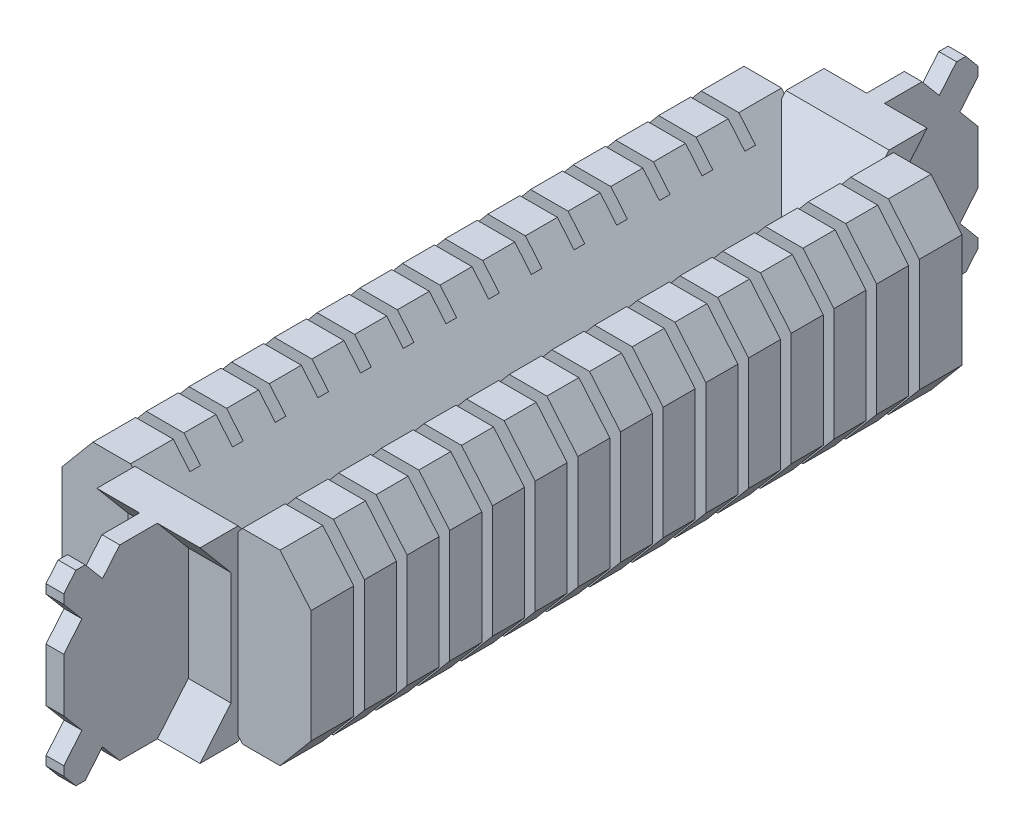
from build123d import *

# Parameters (mm, degrees)
AUFSATZ_LINEAR_AUSTRAGEN2_DEPTH      = 1.8
SCHNITT_LINEAR_AUSTRAGEN1_DEPTH      = 0.5
SCHNITT_LINEAR_AUSTRAGEN2_DEPTH      = 26.347386453
AUFSATZ_LINEAR_AUSTRAGEN3_DEPTH      = 1.2
SCHNITT_LINEAR_AUSTRAGEN3_DEPTH      = 26.734995629
LINEARES_MUSTER1_COUNT               = 15
LINEARES_MUSTER1_PITCH               = 4.8
LINEARES_MUSTER1_COPY_1_DEPTH        = 0.5
LINEARES_MUSTER1_COPY_2_DEPTH        = 0.5
LINEARES_MUSTER1_COPY_3_DEPTH        = 0.5
LINEARES_MUSTER1_COPY_4_DEPTH        = 0.5
LINEARES_MUSTER1_COPY_5_DEPTH        = 0.5
LINEARES_MUSTER1_COPY_6_DEPTH        = 0.5
LINEARES_MUSTER1_COPY_7_DEPTH        = 0.5
LINEARES_MUSTER1_COPY_8_DEPTH        = 0.5
LINEARES_MUSTER1_COPY_9_DEPTH        = 0.5
LINEARES_MUSTER1_COPY_10_DEPTH       = 0.5
LINEARES_MUSTER1_COPY_11_DEPTH       = 0.5
LINEARES_MUSTER1_COPY_12_DEPTH       = 0.5
LINEARES_MUSTER1_COPY_13_DEPTH       = 0.5
LINEARES_MUSTER1_COPY_14_DEPTH       = 0.5
LINEARES_MUSTER1_COPY_15_DEPTH       = 26.347386453
LINEARES_MUSTER1_COPY_16_DEPTH       = 26.347386453
LINEARES_MUSTER1_COPY_17_DEPTH       = 26.347386453
LINEARES_MUSTER1_COPY_18_DEPTH       = 26.347386453
LINEARES_MUSTER1_COPY_19_DEPTH       = 26.347386453
LINEARES_MUSTER1_COPY_20_DEPTH       = 26.347386453
LINEARES_MUSTER1_COPY_21_DEPTH       = 26.347386453
LINEARES_MUSTER1_COPY_22_DEPTH       = 26.347386453
LINEARES_MUSTER1_COPY_23_DEPTH       = 26.347386453
LINEARES_MUSTER1_COPY_24_DEPTH       = 26.347386453
LINEARES_MUSTER1_COPY_25_DEPTH       = 26.347386453
LINEARES_MUSTER1_COPY_26_DEPTH       = 26.347386453
LINEARES_MUSTER1_COPY_27_DEPTH       = 26.347386453
LINEARES_MUSTER1_COPY_28_DEPTH       = 26.347386453
LINEARES_MUSTER1_COPY_29_DEPTH       = 26.734995629
LINEARES_MUSTER1_COPY_30_DEPTH       = 26.734995629
LINEARES_MUSTER1_COPY_31_DEPTH       = 26.734995629
LINEARES_MUSTER1_COPY_32_DEPTH       = 26.734995629
LINEARES_MUSTER1_COPY_33_DEPTH       = 26.734995629
LINEARES_MUSTER1_COPY_34_DEPTH       = 26.734995629
LINEARES_MUSTER1_COPY_35_DEPTH       = 26.734995629
LINEARES_MUSTER1_COPY_36_DEPTH       = 26.734995629
LINEARES_MUSTER1_COPY_37_DEPTH       = 26.734995629
LINEARES_MUSTER1_COPY_38_DEPTH       = 26.734995629
LINEARES_MUSTER1_COPY_39_DEPTH       = 26.734995629
LINEARES_MUSTER1_COPY_40_DEPTH       = 26.734995629
LINEARES_MUSTER1_COPY_41_DEPTH       = 26.734995629
LINEARES_MUSTER1_COPY_42_DEPTH       = 26.734995629
AUFSATZ_LINEAR_AUSTRAGEN4_DEPTH      = 1.2
AUFSATZ_LINEAR_AUSTRAGEN4_DEPTH_BACK = 0.8
AUFSATZ_LINEAR_AUSTRAGEN5_DEPTH      = 1.2
AUFSATZ_LINEAR_AUSTRAGEN5_DEPTH_BACK = 0.8
AUFSATZ_LINEAR_AUSTRAGEN6_DEPTH      = 1
AUFSATZ_LINEAR_AUSTRAGEN7_DEPTH      = 4.8
SPIEGELN11_COPY_1_DEPTH              = 4.8
SPIEGELN11_COPY_2_DEPTH              = 4.8
SCHNITT_LINEAR_AUSTRAGEN6_DEPTH      = 87.949698102


with BuildPart() as part:
    # Skizze3 → Aufsatz-Linear austragen2 (new, symmetric)
    with BuildSketch(Plane.XY):
        Polygon((-9, 3), (-2.706752766, 10.5), (1.519985058, 10.5), (5, 6.352679691), (5, -6.352679691), (1.519985058, -10.5), (-2.706752766, -10.5), (-9, -3), (-15.293247234, -10.5), (-19.519985058, -10.5), (-23, -6.352679691), (-23, 6.352679691), (-19.519985058, 10.5), (-15.293247234, 10.5), align=None)
    aufsatz_linear_austragen2 = extrude(amount=AUFSATZ_LINEAR_AUSTRAGEN2_DEPTH, both=True)

    # Skizze2 → Schnitt-Linear austragen1 (cut, symmetric)
    with BuildSketch(Plane.XY):
        Polygon((-7.551896681, 0), (0, 9), (3, 5.424739222), (3, -5.424739222), (0, -9), align=None)
    schnitt_linear_austragen1 = extrude(amount=SCHNITT_LINEAR_AUSTRAGEN1_DEPTH, both=True, mode=Mode.SUBTRACT)

    # Spiegeln2: Schnitt-Linear austragen1 across plane
    add(schnitt_linear_austragen1.mirror(Plane(origin=(-9, 0, 0), x_dir=(0, 0, 1), z_dir=(1, 0, 0))), mode=Mode.SUBTRACT)

    # Skizze5 → Schnitt-Linear austragen2 (cut, symmetric)
    with BuildSketch(Plane.XY):
        Polygon((-7.551896681, 0), (-6.716272788, 0.995857776), (-5.880648895, 0), (-6.716272788, -0.995857776), align=None)
    schnitt_linear_austragen2 = extrude(amount=SCHNITT_LINEAR_AUSTRAGEN2_DEPTH, both=True, mode=Mode.SUBTRACT)

    # Spiegeln3: Schnitt-Linear austragen2 across plane
    add(schnitt_linear_austragen2.mirror(Plane(origin=(-9, 0, 0), x_dir=(0, 0, 1), z_dir=(1, 0, 0))), mode=Mode.SUBTRACT)

    # Skizze6 → Aufsatz-Linear austragen3 (add)
    with BuildSketch(Plane.XY.offset(1.8)):
        Polygon((-4.580648895, 8.266777556), (-9, 3), (-13.419351105, 8.266777556), (-13.419351105, -8.266777556), (-9, -3), (-4.580648895, -8.266777556), align=None)
    aufsatz_linear_austragen3 = extrude(amount=AUFSATZ_LINEAR_AUSTRAGEN3_DEPTH)

    # Skizze7 → Schnitt-Linear austragen3 (cut, through all)
    with BuildSketch(Plane(origin=(0, 0, -1.8), x_dir=(-1, 0, 0), z_dir=(0, 0, -1))):
        Polygon((6.716272788, -0.995857776), (7.551896681, 0), (6.716272788, 0.995857776), (5.880648895, 0), align=None)
    schnitt_linear_austragen3 = extrude(amount=-SCHNITT_LINEAR_AUSTRAGEN3_DEPTH, mode=Mode.SUBTRACT)

    # Spiegeln4: Schnitt-Linear austragen3 across plane
    add(schnitt_linear_austragen3.mirror(Plane(origin=(-9, 0, 0), x_dir=(0, 0, 1), z_dir=(1, 0, 0))), mode=Mode.SUBTRACT)

    # Lineares Muster1: Aufsatz-Linear austragen2, Schnitt-Linear austragen1, Schnitt-Linear austragen2, Aufsatz-Linear austragen3, Schnitt-Linear austragen3 ×15
    with Locations(*[(0, 0, i * LINEARES_MUSTER1_PITCH) for i in range(1, LINEARES_MUSTER1_COUNT)]):
        add(aufsatz_linear_austragen2)
        add(schnitt_linear_austragen1, mode=Mode.SUBTRACT)
        add(schnitt_linear_austragen2, mode=Mode.SUBTRACT)
        add(aufsatz_linear_austragen3)
        add(schnitt_linear_austragen3, mode=Mode.SUBTRACT)

    # Lineares Muster1 copy 1 sketch → Lineares Muster1 copy 1 (cut, symmetric)
    with BuildSketch(Plane(origin=(-18, 0, 4.8), x_dir=(-1, 0, 0), z_dir=(0, 0, 1))):
        Polygon((-7.551896681, 0), (0, -9), (3, -5.424739222), (3, 5.424739222), (0, 9), align=None)
    extrude(amount=LINEARES_MUSTER1_COPY_1_DEPTH, both=True, mode=Mode.SUBTRACT)

    # Lineares Muster1 copy 2 sketch → Lineares Muster1 copy 2 (cut, symmetric)
    with BuildSketch(Plane(origin=(-18, 0, 9.6), x_dir=(-1, 0, 0), z_dir=(0, 0, 1))):
        Polygon((-7.551896681, 0), (0, -9), (3, -5.424739222), (3, 5.424739222), (0, 9), align=None)
    extrude(amount=LINEARES_MUSTER1_COPY_2_DEPTH, both=True, mode=Mode.SUBTRACT)

    # Lineares Muster1 copy 3 sketch → Lineares Muster1 copy 3 (cut, symmetric)
    with BuildSketch(Plane(origin=(-18, 0, 14.4), x_dir=(-1, 0, 0), z_dir=(0, 0, 1))):
        Polygon((-7.551896681, 0), (0, -9), (3, -5.424739222), (3, 5.424739222), (0, 9), align=None)
    extrude(amount=LINEARES_MUSTER1_COPY_3_DEPTH, both=True, mode=Mode.SUBTRACT)

    # Lineares Muster1 copy 4 sketch → Lineares Muster1 copy 4 (cut, symmetric)
    with BuildSketch(Plane(origin=(-18, 0, 19.2), x_dir=(-1, 0, 0), z_dir=(0, 0, 1))):
        Polygon((-7.551896681, 0), (0, -9), (3, -5.424739222), (3, 5.424739222), (0, 9), align=None)
    extrude(amount=LINEARES_MUSTER1_COPY_4_DEPTH, both=True, mode=Mode.SUBTRACT)

    # Lineares Muster1 copy 5 sketch → Lineares Muster1 copy 5 (cut, symmetric)
    with BuildSketch(Plane(origin=(-18, 0, 24), x_dir=(-1, 0, 0), z_dir=(0, 0, 1))):
        Polygon((-7.551896681, 0), (0, -9), (3, -5.424739222), (3, 5.424739222), (0, 9), align=None)
    extrude(amount=LINEARES_MUSTER1_COPY_5_DEPTH, both=True, mode=Mode.SUBTRACT)

    # Lineares Muster1 copy 6 sketch → Lineares Muster1 copy 6 (cut, symmetric)
    with BuildSketch(Plane(origin=(-18, 0, 28.8), x_dir=(-1, 0, 0), z_dir=(0, 0, 1))):
        Polygon((-7.551896681, 0), (0, -9), (3, -5.424739222), (3, 5.424739222), (0, 9), align=None)
    extrude(amount=LINEARES_MUSTER1_COPY_6_DEPTH, both=True, mode=Mode.SUBTRACT)

    # Lineares Muster1 copy 7 sketch → Lineares Muster1 copy 7 (cut, symmetric)
    with BuildSketch(Plane(origin=(-18, 0, 33.6), x_dir=(-1, 0, 0), z_dir=(0, 0, 1))):
        Polygon((-7.551896681, 0), (0, -9), (3, -5.424739222), (3, 5.424739222), (0, 9), align=None)
    extrude(amount=LINEARES_MUSTER1_COPY_7_DEPTH, both=True, mode=Mode.SUBTRACT)

    # Lineares Muster1 copy 8 sketch → Lineares Muster1 copy 8 (cut, symmetric)
    with BuildSketch(Plane(origin=(-18, 0, 38.4), x_dir=(-1, 0, 0), z_dir=(0, 0, 1))):
        Polygon((-7.551896681, 0), (0, -9), (3, -5.424739222), (3, 5.424739222), (0, 9), align=None)
    extrude(amount=LINEARES_MUSTER1_COPY_8_DEPTH, both=True, mode=Mode.SUBTRACT)

    # Lineares Muster1 copy 9 sketch → Lineares Muster1 copy 9 (cut, symmetric)
    with BuildSketch(Plane(origin=(-18, 0, 43.2), x_dir=(-1, 0, 0), z_dir=(0, 0, 1))):
        Polygon((-7.551896681, 0), (0, -9), (3, -5.424739222), (3, 5.424739222), (0, 9), align=None)
    extrude(amount=LINEARES_MUSTER1_COPY_9_DEPTH, both=True, mode=Mode.SUBTRACT)

    # Lineares Muster1 copy 10 sketch → Lineares Muster1 copy 10 (cut, symmetric)
    with BuildSketch(Plane(origin=(-18, 0, 48), x_dir=(-1, 0, 0), z_dir=(0, 0, 1))):
        Polygon((-7.551896681, 0), (0, -9), (3, -5.424739222), (3, 5.424739222), (0, 9), align=None)
    extrude(amount=LINEARES_MUSTER1_COPY_10_DEPTH, both=True, mode=Mode.SUBTRACT)

    # Lineares Muster1 copy 11 sketch → Lineares Muster1 copy 11 (cut, symmetric)
    with BuildSketch(Plane(origin=(-18, 0, 52.8), x_dir=(-1, 0, 0), z_dir=(0, 0, 1))):
        Polygon((-7.551896681, 0), (0, -9), (3, -5.424739222), (3, 5.424739222), (0, 9), align=None)
    extrude(amount=LINEARES_MUSTER1_COPY_11_DEPTH, both=True, mode=Mode.SUBTRACT)

    # Lineares Muster1 copy 12 sketch → Lineares Muster1 copy 12 (cut, symmetric)
    with BuildSketch(Plane(origin=(-18, 0, 57.6), x_dir=(-1, 0, 0), z_dir=(0, 0, 1))):
        Polygon((-7.551896681, 0), (0, -9), (3, -5.424739222), (3, 5.424739222), (0, 9), align=None)
    extrude(amount=LINEARES_MUSTER1_COPY_12_DEPTH, both=True, mode=Mode.SUBTRACT)

    # Lineares Muster1 copy 13 sketch → Lineares Muster1 copy 13 (cut, symmetric)
    with BuildSketch(Plane(origin=(-18, 0, 62.4), x_dir=(-1, 0, 0), z_dir=(0, 0, 1))):
        Polygon((-7.551896681, 0), (0, -9), (3, -5.424739222), (3, 5.424739222), (0, 9), align=None)
    extrude(amount=LINEARES_MUSTER1_COPY_13_DEPTH, both=True, mode=Mode.SUBTRACT)

    # Lineares Muster1 copy 14 sketch → Lineares Muster1 copy 14 (cut, symmetric)
    with BuildSketch(Plane(origin=(-18, 0, 67.2), x_dir=(-1, 0, 0), z_dir=(0, 0, 1))):
        Polygon((-7.551896681, 0), (0, -9), (3, -5.424739222), (3, 5.424739222), (0, 9), align=None)
    extrude(amount=LINEARES_MUSTER1_COPY_14_DEPTH, both=True, mode=Mode.SUBTRACT)

    # Lineares Muster1 copy 15 sketch → Lineares Muster1 copy 15 (cut, symmetric)
    with BuildSketch(Plane(origin=(-18, 0, 4.8), x_dir=(-1, 0, 0), z_dir=(0, 0, 1))):
        Polygon((-7.551896681, 0), (-6.716272788, -0.995857776), (-5.880648895, 0), (-6.716272788, 0.995857776), align=None)
    extrude(amount=LINEARES_MUSTER1_COPY_15_DEPTH, both=True, mode=Mode.SUBTRACT)

    # Lineares Muster1 copy 16 sketch → Lineares Muster1 copy 16 (cut, symmetric)
    with BuildSketch(Plane(origin=(-18, 0, 9.6), x_dir=(-1, 0, 0), z_dir=(0, 0, 1))):
        Polygon((-7.551896681, 0), (-6.716272788, -0.995857776), (-5.880648895, 0), (-6.716272788, 0.995857776), align=None)
    extrude(amount=LINEARES_MUSTER1_COPY_16_DEPTH, both=True, mode=Mode.SUBTRACT)

    # Lineares Muster1 copy 17 sketch → Lineares Muster1 copy 17 (cut, symmetric)
    with BuildSketch(Plane(origin=(-18, 0, 14.4), x_dir=(-1, 0, 0), z_dir=(0, 0, 1))):
        Polygon((-7.551896681, 0), (-6.716272788, -0.995857776), (-5.880648895, 0), (-6.716272788, 0.995857776), align=None)
    extrude(amount=LINEARES_MUSTER1_COPY_17_DEPTH, both=True, mode=Mode.SUBTRACT)

    # Lineares Muster1 copy 18 sketch → Lineares Muster1 copy 18 (cut, symmetric)
    with BuildSketch(Plane(origin=(-18, 0, 19.2), x_dir=(-1, 0, 0), z_dir=(0, 0, 1))):
        Polygon((-7.551896681, 0), (-6.716272788, -0.995857776), (-5.880648895, 0), (-6.716272788, 0.995857776), align=None)
    extrude(amount=LINEARES_MUSTER1_COPY_18_DEPTH, both=True, mode=Mode.SUBTRACT)

    # Lineares Muster1 copy 19 sketch → Lineares Muster1 copy 19 (cut, symmetric)
    with BuildSketch(Plane(origin=(-18, 0, 24), x_dir=(-1, 0, 0), z_dir=(0, 0, 1))):
        Polygon((-7.551896681, 0), (-6.716272788, -0.995857776), (-5.880648895, 0), (-6.716272788, 0.995857776), align=None)
    extrude(amount=LINEARES_MUSTER1_COPY_19_DEPTH, both=True, mode=Mode.SUBTRACT)

    # Lineares Muster1 copy 20 sketch → Lineares Muster1 copy 20 (cut, symmetric)
    with BuildSketch(Plane(origin=(-18, 0, 28.8), x_dir=(-1, 0, 0), z_dir=(0, 0, 1))):
        Polygon((-7.551896681, 0), (-6.716272788, -0.995857776), (-5.880648895, 0), (-6.716272788, 0.995857776), align=None)
    extrude(amount=LINEARES_MUSTER1_COPY_20_DEPTH, both=True, mode=Mode.SUBTRACT)

    # Lineares Muster1 copy 21 sketch → Lineares Muster1 copy 21 (cut, symmetric)
    with BuildSketch(Plane(origin=(-18, 0, 33.6), x_dir=(-1, 0, 0), z_dir=(0, 0, 1))):
        Polygon((-7.551896681, 0), (-6.716272788, -0.995857776), (-5.880648895, 0), (-6.716272788, 0.995857776), align=None)
    extrude(amount=LINEARES_MUSTER1_COPY_21_DEPTH, both=True, mode=Mode.SUBTRACT)

    # Lineares Muster1 copy 22 sketch → Lineares Muster1 copy 22 (cut, symmetric)
    with BuildSketch(Plane(origin=(-18, 0, 38.4), x_dir=(-1, 0, 0), z_dir=(0, 0, 1))):
        Polygon((-7.551896681, 0), (-6.716272788, -0.995857776), (-5.880648895, 0), (-6.716272788, 0.995857776), align=None)
    extrude(amount=LINEARES_MUSTER1_COPY_22_DEPTH, both=True, mode=Mode.SUBTRACT)

    # Lineares Muster1 copy 23 sketch → Lineares Muster1 copy 23 (cut, symmetric)
    with BuildSketch(Plane(origin=(-18, 0, 43.2), x_dir=(-1, 0, 0), z_dir=(0, 0, 1))):
        Polygon((-7.551896681, 0), (-6.716272788, -0.995857776), (-5.880648895, 0), (-6.716272788, 0.995857776), align=None)
    extrude(amount=LINEARES_MUSTER1_COPY_23_DEPTH, both=True, mode=Mode.SUBTRACT)

    # Lineares Muster1 copy 24 sketch → Lineares Muster1 copy 24 (cut, symmetric)
    with BuildSketch(Plane(origin=(-18, 0, 48), x_dir=(-1, 0, 0), z_dir=(0, 0, 1))):
        Polygon((-7.551896681, 0), (-6.716272788, -0.995857776), (-5.880648895, 0), (-6.716272788, 0.995857776), align=None)
    extrude(amount=LINEARES_MUSTER1_COPY_24_DEPTH, both=True, mode=Mode.SUBTRACT)

    # Lineares Muster1 copy 25 sketch → Lineares Muster1 copy 25 (cut, symmetric)
    with BuildSketch(Plane(origin=(-18, 0, 52.8), x_dir=(-1, 0, 0), z_dir=(0, 0, 1))):
        Polygon((-7.551896681, 0), (-6.716272788, -0.995857776), (-5.880648895, 0), (-6.716272788, 0.995857776), align=None)
    extrude(amount=LINEARES_MUSTER1_COPY_25_DEPTH, both=True, mode=Mode.SUBTRACT)

    # Lineares Muster1 copy 26 sketch → Lineares Muster1 copy 26 (cut, symmetric)
    with BuildSketch(Plane(origin=(-18, 0, 57.6), x_dir=(-1, 0, 0), z_dir=(0, 0, 1))):
        Polygon((-7.551896681, 0), (-6.716272788, -0.995857776), (-5.880648895, 0), (-6.716272788, 0.995857776), align=None)
    extrude(amount=LINEARES_MUSTER1_COPY_26_DEPTH, both=True, mode=Mode.SUBTRACT)

    # Lineares Muster1 copy 27 sketch → Lineares Muster1 copy 27 (cut, symmetric)
    with BuildSketch(Plane(origin=(-18, 0, 62.4), x_dir=(-1, 0, 0), z_dir=(0, 0, 1))):
        Polygon((-7.551896681, 0), (-6.716272788, -0.995857776), (-5.880648895, 0), (-6.716272788, 0.995857776), align=None)
    extrude(amount=LINEARES_MUSTER1_COPY_27_DEPTH, both=True, mode=Mode.SUBTRACT)

    # Lineares Muster1 copy 28 sketch → Lineares Muster1 copy 28 (cut, symmetric)
    with BuildSketch(Plane(origin=(-18, 0, 67.2), x_dir=(-1, 0, 0), z_dir=(0, 0, 1))):
        Polygon((-7.551896681, 0), (-6.716272788, -0.995857776), (-5.880648895, 0), (-6.716272788, 0.995857776), align=None)
    extrude(amount=LINEARES_MUSTER1_COPY_28_DEPTH, both=True, mode=Mode.SUBTRACT)

    # Lineares Muster1 copy 29 sketch → Lineares Muster1 copy 29 (cut, through all)
    with BuildSketch(Plane(origin=(-18, 0, 3), x_dir=(1, 0, 0), z_dir=(0, 0, -1))):
        Polygon((6.716272788, 0.995857776), (7.551896681, 0), (6.716272788, -0.995857776), (5.880648895, 0), align=None)
    extrude(amount=-LINEARES_MUSTER1_COPY_29_DEPTH, mode=Mode.SUBTRACT)

    # Lineares Muster1 copy 30 sketch → Lineares Muster1 copy 30 (cut, through all)
    with BuildSketch(Plane(origin=(-18, 0, 7.8), x_dir=(1, 0, 0), z_dir=(0, 0, -1))):
        Polygon((6.716272788, 0.995857776), (7.551896681, 0), (6.716272788, -0.995857776), (5.880648895, 0), align=None)
    extrude(amount=-LINEARES_MUSTER1_COPY_30_DEPTH, mode=Mode.SUBTRACT)

    # Lineares Muster1 copy 31 sketch → Lineares Muster1 copy 31 (cut, through all)
    with BuildSketch(Plane(origin=(-18, 0, 12.6), x_dir=(1, 0, 0), z_dir=(0, 0, -1))):
        Polygon((6.716272788, 0.995857776), (7.551896681, 0), (6.716272788, -0.995857776), (5.880648895, 0), align=None)
    extrude(amount=-LINEARES_MUSTER1_COPY_31_DEPTH, mode=Mode.SUBTRACT)

    # Lineares Muster1 copy 32 sketch → Lineares Muster1 copy 32 (cut, through all)
    with BuildSketch(Plane(origin=(-18, 0, 17.4), x_dir=(1, 0, 0), z_dir=(0, 0, -1))):
        Polygon((6.716272788, 0.995857776), (7.551896681, 0), (6.716272788, -0.995857776), (5.880648895, 0), align=None)
    extrude(amount=-LINEARES_MUSTER1_COPY_32_DEPTH, mode=Mode.SUBTRACT)

    # Lineares Muster1 copy 33 sketch → Lineares Muster1 copy 33 (cut, through all)
    with BuildSketch(Plane(origin=(-18, 0, 22.2), x_dir=(1, 0, 0), z_dir=(0, 0, -1))):
        Polygon((6.716272788, 0.995857776), (7.551896681, 0), (6.716272788, -0.995857776), (5.880648895, 0), align=None)
    extrude(amount=-LINEARES_MUSTER1_COPY_33_DEPTH, mode=Mode.SUBTRACT)

    # Lineares Muster1 copy 34 sketch → Lineares Muster1 copy 34 (cut, through all)
    with BuildSketch(Plane(origin=(-18, 0, 27), x_dir=(1, 0, 0), z_dir=(0, 0, -1))):
        Polygon((6.716272788, 0.995857776), (7.551896681, 0), (6.716272788, -0.995857776), (5.880648895, 0), align=None)
    extrude(amount=-LINEARES_MUSTER1_COPY_34_DEPTH, mode=Mode.SUBTRACT)

    # Lineares Muster1 copy 35 sketch → Lineares Muster1 copy 35 (cut, through all)
    with BuildSketch(Plane(origin=(-18, 0, 31.8), x_dir=(1, 0, 0), z_dir=(0, 0, -1))):
        Polygon((6.716272788, 0.995857776), (7.551896681, 0), (6.716272788, -0.995857776), (5.880648895, 0), align=None)
    extrude(amount=-LINEARES_MUSTER1_COPY_35_DEPTH, mode=Mode.SUBTRACT)

    # Lineares Muster1 copy 36 sketch → Lineares Muster1 copy 36 (cut, through all)
    with BuildSketch(Plane(origin=(-18, 0, 36.6), x_dir=(1, 0, 0), z_dir=(0, 0, -1))):
        Polygon((6.716272788, 0.995857776), (7.551896681, 0), (6.716272788, -0.995857776), (5.880648895, 0), align=None)
    extrude(amount=-LINEARES_MUSTER1_COPY_36_DEPTH, mode=Mode.SUBTRACT)

    # Lineares Muster1 copy 37 sketch → Lineares Muster1 copy 37 (cut, through all)
    with BuildSketch(Plane(origin=(-18, 0, 41.4), x_dir=(1, 0, 0), z_dir=(0, 0, -1))):
        Polygon((6.716272788, 0.995857776), (7.551896681, 0), (6.716272788, -0.995857776), (5.880648895, 0), align=None)
    extrude(amount=-LINEARES_MUSTER1_COPY_37_DEPTH, mode=Mode.SUBTRACT)

    # Lineares Muster1 copy 38 sketch → Lineares Muster1 copy 38 (cut, through all)
    with BuildSketch(Plane(origin=(-18, 0, 46.2), x_dir=(1, 0, 0), z_dir=(0, 0, -1))):
        Polygon((6.716272788, 0.995857776), (7.551896681, 0), (6.716272788, -0.995857776), (5.880648895, 0), align=None)
    extrude(amount=-LINEARES_MUSTER1_COPY_38_DEPTH, mode=Mode.SUBTRACT)

    # Lineares Muster1 copy 39 sketch → Lineares Muster1 copy 39 (cut, through all)
    with BuildSketch(Plane(origin=(-18, 0, 51), x_dir=(1, 0, 0), z_dir=(0, 0, -1))):
        Polygon((6.716272788, 0.995857776), (7.551896681, 0), (6.716272788, -0.995857776), (5.880648895, 0), align=None)
    extrude(amount=-LINEARES_MUSTER1_COPY_39_DEPTH, mode=Mode.SUBTRACT)

    # Lineares Muster1 copy 40 sketch → Lineares Muster1 copy 40 (cut, through all)
    with BuildSketch(Plane(origin=(-18, 0, 55.8), x_dir=(1, 0, 0), z_dir=(0, 0, -1))):
        Polygon((6.716272788, 0.995857776), (7.551896681, 0), (6.716272788, -0.995857776), (5.880648895, 0), align=None)
    extrude(amount=-LINEARES_MUSTER1_COPY_40_DEPTH, mode=Mode.SUBTRACT)

    # Lineares Muster1 copy 41 sketch → Lineares Muster1 copy 41 (cut, through all)
    with BuildSketch(Plane(origin=(-18, 0, 60.6), x_dir=(1, 0, 0), z_dir=(0, 0, -1))):
        Polygon((6.716272788, 0.995857776), (7.551896681, 0), (6.716272788, -0.995857776), (5.880648895, 0), align=None)
    extrude(amount=-LINEARES_MUSTER1_COPY_41_DEPTH, mode=Mode.SUBTRACT)

    # Lineares Muster1 copy 42 sketch → Lineares Muster1 copy 42 (cut, through all)
    with BuildSketch(Plane(origin=(-18, 0, 65.4), x_dir=(1, 0, 0), z_dir=(0, 0, -1))):
        Polygon((6.716272788, 0.995857776), (7.551896681, 0), (6.716272788, -0.995857776), (5.880648895, 0), align=None)
    extrude(amount=-LINEARES_MUSTER1_COPY_42_DEPTH, mode=Mode.SUBTRACT)

    # Skizze8 → Aufsatz-Linear austragen4 (add, two sides: drawn at the far end of the back side and taken through both)
    with BuildSketch(Plane(origin=(0, 0, -1.8), x_dir=(-1, 0, 0), z_dir=(0, 0, -1)).offset(-AUFSATZ_LINEAR_AUSTRAGEN4_DEPTH_BACK)):
        Polygon((2.706752766, -10.5), (9, -3), (15.293247234, -10.5), (19.519985058, -10.5), (23, -6.352679691), (23, 6.352679691), (19.519985058, 10.5), (15.293247234, 10.5), (9, 3), (2.706752766, 10.5), (-1.519985058, 10.5), (-5, 6.352679691), (-5, -6.352679691), (-1.519985058, -10.5), align=None)
    extrude(amount=AUFSATZ_LINEAR_AUSTRAGEN4_DEPTH + AUFSATZ_LINEAR_AUSTRAGEN4_DEPTH_BACK)

    # Skizze9 → Aufsatz-Linear austragen5 (add, two sides: drawn at the far end of the back side and taken through both)
    with BuildSketch(Plane.XY.offset(69).offset(-AUFSATZ_LINEAR_AUSTRAGEN5_DEPTH_BACK)):
        Polygon((-2.706752766, -10.5), (1.519985058, -10.5), (5, -6.352679691), (5, 6.352679691), (1.519985058, 10.5), (-2.706752766, 10.5), (-9, 3), (-15.293247234, 10.5), (-19.519985058, 10.5), (-23, 6.352679691), (-23, -6.352679691), (-19.519985058, -10.5), (-15.293247234, -10.5), (-9, -3), align=None)
    extrude(amount=AUFSATZ_LINEAR_AUSTRAGEN5_DEPTH + AUFSATZ_LINEAR_AUSTRAGEN5_DEPTH_BACK)

    # Skizze10 → Aufsatz-Linear austragen6 (add, symmetric)
    with BuildSketch(Plane(origin=(-9, 0, 0), x_dir=(0, 0, -1), z_dir=(1, 0, 0))):
        Polygon((-3.293247234, 3), (3, 10.5), (17.8, 10.5), (17.8, -10.5), (3, -10.5), (-3.293247234, -3), (3, -3), (3, 3), align=None)
    aufsatz_linear_austragen6 = extrude(amount=AUFSATZ_LINEAR_AUSTRAGEN6_DEPTH, both=True)

    # Spiegeln5: Aufsatz-Linear austragen6 across plane
    add(aufsatz_linear_austragen6.mirror(Plane.XY.offset(33.6)))

    # Skizze12 → Aufsatz-Linear austragen7 (add)
    with BuildSketch(Plane(origin=(-8, 0, 0), x_dir=(0, 0, -1), z_dir=(1, 0, 0))):
        Polygon((-2.293247234, 4.191753593), (3, 10.5), (7.280014942, 10.5), (3.8, 6.352679691), (3.8, -6.352679691), (7.280014942, -10.5), (3, -10.5), (-2.293247234, -4.191753593), (3, -4.191753593), (3, 4.191753593), align=None)
    aufsatz_linear_austragen7 = extrude(amount=AUFSATZ_LINEAR_AUSTRAGEN7_DEPTH)

    # Spiegeln6: Aufsatz-Linear austragen7 across plane
    add(aufsatz_linear_austragen7.mirror(Plane.XY.offset(33.6)))

    # Spiegeln10: Aufsatz-Linear austragen7 across plane
    add(aufsatz_linear_austragen7.mirror(Plane(origin=(-9, 0, 0), x_dir=(0, 0, 1), z_dir=(1, 0, 0))))

    # Spiegeln11 copy 1 sketch → Spiegeln11 copy 1 (add)
    with BuildSketch(Plane(origin=(-10, 0, 67.2), x_dir=(0, 0, 1), z_dir=(-1, 0, 0))):
        Polygon((-2.293247234, 4.191753593), (3, 10.5), (7.280014942, 10.5), (3.8, 6.352679691), (3.8, -6.352679691), (7.280014942, -10.5), (3, -10.5), (-2.293247234, -4.191753593), (3, -4.191753593), (3, 4.191753593), align=None)
    extrude(amount=SPIEGELN11_COPY_1_DEPTH)

    # Spiegeln11 copy 2 sketch → Spiegeln11 copy 2 (add)
    with BuildSketch(Plane(origin=(-8, 0, 67.2), x_dir=(0, 0, 1), z_dir=(1, 0, 0))):
        Polygon((-2.293247234, -4.191753593), (3, -10.5), (7.280014942, -10.5), (3.8, -6.352679691), (3.8, 6.352679691), (7.280014942, 10.5), (3, 10.5), (-2.293247234, 4.191753593), (3, 4.191753593), (3, -4.191753593), align=None)
    extrude(amount=SPIEGELN11_COPY_2_DEPTH)

    # Skizze16 → Schnitt-Linear austragen6 (cut, through all)
    with BuildSketch(Plane(origin=(-8, 0, 0), x_dir=(0, 0, -1), z_dir=(1, 0, 0))):
        Polygon((17.8, 3), (15.76212397, 5.42864608), (17.8, 7.85729216), align=None)
        Polygon((17.8, 8.878530067), (16.439425177, 10.5), (17.8, 10.5), align=None)
        Polygon((15.389424384, 10.5), (13.448088575, 8.186406075), (11.506752766, 10.5), align=None)
        Polygon((17.8, -7.85729216), (17.8, -3), (15.76212397, -5.42864608), align=None)
        Polygon((17.8, -10.5), (17.8, -8.878530067), (16.439425177, -10.5), align=None)
        Polygon((15.389424384, -10.5), (13.448088575, -8.186406075), (11.506752766, -10.5), align=None)
        Polygon((-80.648088575, -8.186406075), (-78.706752766, -10.5), (-82.589424384, -10.5), align=None)
        Polygon((-85, -8.878530067), (-83.639425177, -10.5), (-85, -10.5), align=None)
        Polygon((-82.96212397, -5.42864608), (-85, -7.85729216), (-85, -3), align=None)
        Polygon((-85, 7.85729216), (-85, 3), (-82.96212397, 5.42864608), align=None)
        Polygon((-85, 10.5), (-85, 8.878530067), (-83.639425177, 10.5), align=None)
        Polygon((-82.589424384, 10.5), (-80.648088575, 8.186406075), (-78.706752766, 10.5), align=None)
    extrude(amount=-SCHNITT_LINEAR_AUSTRAGEN6_DEPTH, mode=Mode.SUBTRACT)


solid = part.part
